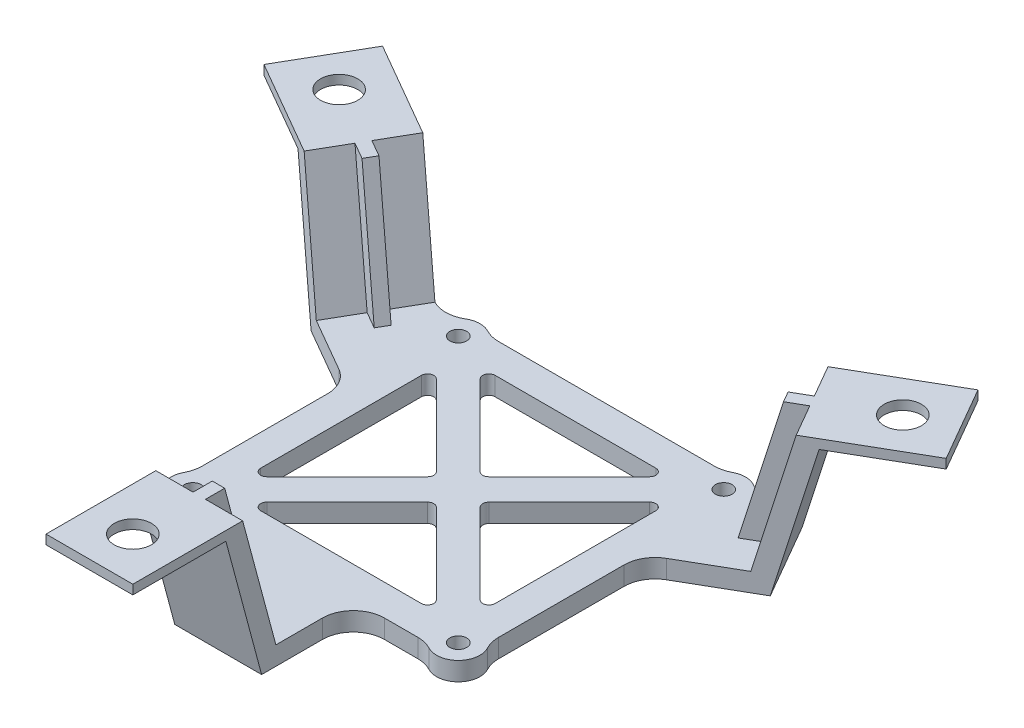
from build123d import *

# Parameters (mm, degrees)
SKETCH1_R           = 1.35
BOSS_EXTRUDE1_DEPTH = 3
FILLET1_R           = 5
FILLET2_R           = 1
BOSS_EXTRUDE2_DEPTH = 7
BOSS_EXTRUDE3_DEPTH = 1
CUT_EXTRUDE1_REACH  = 74.282
SKETCH3_R           = 3
CIRPATTERN3_COUNT   = 3


with BuildPart() as part:
    # Sketch1 → Boss-Extrude1 (new body)
    with BuildSketch(Plane(origin=(0, 0, 0), x_dir=(1, 0, 0), z_dir=(0, 1, 0))):
        with BuildLine():
            ThreePointArc((-18.950510257, 23.9), (-22.286742625, 24.785806775), (-24.760474821, 22.378370572))
            Line((-24.760474821, 22.378370572), (-28.023324698, 24.262177826))
            Line((-28.023324698, 24.262177826), (-35.023324698, 12.137822174))
            Line((-35.023324698, 12.137822174), (-23.9, 5.715767665))
            Line((-23.9, 5.715767665), (-23.9, -18.950510257))
            ThreePointArc((-23.9, -18.950510257), (-23.874873734, -23.874873734), (-18.950510257, -23.9))
            Line((-18.950510257, -23.9), (-7, -23.9))
            Line((-7, -23.9), (-7, -36.4))
            Line((-7, -36.4), (7, -36.4))
            Line((7, -36.4), (7, -23.9))
            Line((7, -23.9), (18.950510257, -23.9))
            ThreePointArc((18.950510257, -23.9), (23.874873734, -23.874873734), (23.9, -18.950510257))
            Line((23.9, -18.950510257), (23.9, 5.715767665))
            Line((23.9, 5.715767665), (35.023324698, 12.137822174))
            Line((35.023324698, 12.137822174), (28.023324698, 24.262177826))
            Line((28.023324698, 24.262177826), (24.760474821, 22.378370572))
            ThreePointArc((24.760474821, 22.378370572), (22.286742625, 24.785806775), (18.950510257, 23.9))
            Line((18.950510257, 23.9), (-18.950510257, 23.9))
        make_face()
        with Locations(Location((-21.4, -21.4, 0), (0, 0, 270))):
            Circle(SKETCH1_R, mode=Mode.SUBTRACT)
        Polygon((15.364466094, -18.9), (-15.364466094, -18.9), (0, -3.535533906), align=None, mode=Mode.SUBTRACT)
        with Locations(Location((21.4, -21.4, 0), (0, 0, 270))):
            Circle(SKETCH1_R, mode=Mode.SUBTRACT)
        Polygon((-3.535533906, 0), (-18.9, -15.364466094), (-18.9, 15.364466094), align=None, mode=Mode.SUBTRACT)
        with Locations(Location((-21.4, 21.4, 0), (0, 0, 270))):
            Circle(SKETCH1_R, mode=Mode.SUBTRACT)
        Polygon((18.9, -15.364466094), (3.535533906, 0), (18.9, 15.364466094), align=None, mode=Mode.SUBTRACT)
        Polygon((0, 3.535533906), (-15.364466094, 18.9), (15.364466094, 18.9), align=None, mode=Mode.SUBTRACT)
        with Locations(Location((21.4, 21.4, 0), (0, 0, 270))):
            Circle(SKETCH1_R, mode=Mode.SUBTRACT)
    extrude(amount=BOSS_EXTRUDE1_DEPTH)

    # Fillet1
    # the kernel refuses this fillet: 5 mm, written as the material it adds along each edge
    with BuildSketch(Plane(origin=(7, 0, 23.9), x_dir=(0, 0, 1), z_dir=(0, 1, 0)), Plane(origin=(-7, 0, 23.9), x_dir=(-1, 0, 0), z_dir=(0, 1, 0))) as fillet1_piece_1:
        with BuildLine():
            CenterArc((FILLET1_R, FILLET1_R), FILLET1_R, 180, 90)
            Line((0, FILLET1_R), (-FILLET1_R * 0.02, FILLET1_R))
            Line((-FILLET1_R * 0.02, FILLET1_R), (-FILLET1_R * 0.02, -FILLET1_R * 0.02))
            Line((-FILLET1_R * 0.02, -FILLET1_R * 0.02), (FILLET1_R, -FILLET1_R * 0.02))
            Line((FILLET1_R, -FILLET1_R * 0.02), (FILLET1_R, 0))
        make_face()
    extrude(amount=3)
    with BuildSketch(Plane(origin=(23.9, 0, 18.950510257), x_dir=(0.5912237553807399, 0, 0.8065075765753815), z_dir=(0, 1, 0)), Plane(origin=(-18.950510257, 0, 23.9), x_dir=(-0.806507576575308, 0, 0.5912237553808403), z_dir=(0, 1, 0)), Plane(origin=(18.950510257, 0, -23.9), x_dir=(0.8065075765752107, 0, -0.591223755380973), z_dir=(0, 1, 0))) as fillet1_piece_2:
        with BuildLine():
            CenterArc((1.705620507, 4.94923638), FILLET1_R, 233.756102233, 28.072486936)
            Line((-1.25049827, 0.916698497), (-1.309620646, 0.836047739))
            Line((-1.309620646, 0.836047739), (-0.059122376, -0.080650758))
            Line((-0.059122376, -0.080650758), (0.014213504, -0.098984728))
            ThreePointArc((0.014213504, -0.098984728), (0.497472648, -0.064465466), (0.980731791, -0.098984728))
            Line((0.980731791, -0.098984728), (0.994945296, 0))
        make_face()
    extrude(amount=3)
    with BuildSketch(Plane(origin=(18.950510257, 0, 23.9), x_dir=(-1, 0, 0), z_dir=(0, 1, 0)), Plane(origin=(-23.9, 0, 18.950510257), x_dir=(0, 0, -1), z_dir=(0, 1, 0)), Plane(origin=(-18.950510257, 0, -23.9), x_dir=(1, 0, 0), z_dir=(0, 1, 0))) as fillet1_piece_3:
        with BuildLine():
            CenterArc((1.550510257, 5), FILLET1_R, 241.927513064, 28.072486936)
            Line((-0.802430919, 0.588235294), (-0.849489743, 0.5))
            ThreePointArc((-0.849489743, 0.5), (-0.439328974, 0.24212576), (-0.069985421, -0.071428571))
            Line((-0.069985421, -0.071428571), (0, -0.1))
            Line((0, -0.1), (1.550510257, -0.1))
            Line((1.550510257, -0.1), (1.550510257, 0))
        make_face()
    extrude(amount=3)
    with BuildSketch(Plane(origin=(-23.9, 0, -5.715767665), x_dir=(-0.8660254037844421, 0, -0.49999999999999417), z_dir=(0, 1, 0)), Plane(origin=(23.9, 0, -5.715767665), x_dir=(0, 0, 1), z_dir=(0, 1, 0))) as fillet1_piece_4:
        with BuildLine():
            CenterArc((FILLET1_R * 0.57735026919, FILLET1_R), FILLET1_R, 210, 60)
            Line((-FILLET1_R * 0.288675134595, FILLET1_R * 0.5), (-FILLET1_R * 0.30599564267, FILLET1_R * 0.49))
            Line((-FILLET1_R * 0.30599564267, FILLET1_R * 0.49), (-FILLET1_R * 0.0115470053838, -FILLET1_R * 0.02))
            Line((-FILLET1_R * 0.0115470053838, -FILLET1_R * 0.02), (FILLET1_R * 0.57735026919, -FILLET1_R * 0.02))
            Line((FILLET1_R * 0.57735026919, -FILLET1_R * 0.02), (FILLET1_R * 0.57735026919, 0))
        make_face()
    extrude(amount=3)
    with BuildSketch(Plane(origin=(24.760474821, 0, -22.378370572), x_dir=(-0.6125107821213894, 0, -0.7904622329909531), z_dir=(0, 1, 0))) as fillet1_piece_5:
        with BuildLine():
            CenterArc((4.405584254, -4.650844222), FILLET1_R, 111.538849964, 57.883583887)
            Line((-0.509452241, -3.733011854), (-0.607752971, -3.714655207))
            ThreePointArc((-0.607752971, -3.714655207), (-0.353807697, -1.852984049), (-0.099081577, 0.013521878))
            Line((-0.099081577, 0.013521878), (0.036713202, 0.093016884))
            ThreePointArc((0.036713202, 0.093016884), (1.284962074, -0.144409045), (2.533210946, 0.093016884))
            Line((2.533210946, 0.093016884), (2.569924148, 0))
        make_face()
    extrude(amount=3)
    with BuildSketch(Plane(origin=(-24.760474821, 0, -22.378370572), x_dir=(0.6125107821216187, 0, -0.7904622329907753), z_dir=(0, 1, 0))) as fillet1_piece_6:
        with BuildLine():
            CenterArc((4.405584254, 4.650844222), FILLET1_R, 190.577566149, 57.883583887)
            Line((-0.509452241, 3.733011854), (-0.607752971, 3.714655207))
            ThreePointArc((-0.607752971, 3.714655207), (-0.353807697, 1.852984049), (-0.099081577, -0.013521878))
            Line((-0.099081577, -0.013521878), (0.036713202, -0.093016884))
            ThreePointArc((0.036713202, -0.093016884), (1.284962074, 0.144409045), (2.533210946, -0.093016884))
            Line((2.533210946, -0.093016884), (2.569924148, 0))
        make_face()
    extrude(amount=3)

    # Fillet2
    fillet2_edges = [part.edges().sort_by_distance(p)[0] for p in [
        (15.364466094, 1.5, -18.9),
        (-15.364466094, 1.5, -18.9),
        (0, 1.5, -3.535533906),
        (-18.9, 1.5, 15.364466094),
        (-3.535533906, 1.5, 0),
        (-18.9, 1.5, -15.364466094),
        (18.9, 1.5, 15.364466094),
        (18.9, 1.5, -15.364466094),
        (3.535533906, 1.5, 0),
        (-15.364466094, 1.5, 18.9),
        (15.364466094, 1.5, 18.9),
        (0, 1.5, 3.535533906),
    ]]
    fillet(fillet2_edges, radius=FILLET2_R)

    # Sketch2 → Boss-Extrude2 (add, symmetric)
    with BuildSketch(Plane(origin=(0, 0, 0), x_dir=(0, 0, -1), z_dir=(1, 0, 0))):
        Polygon((-36.4, 3), (-36.4, 0), (-38.701980964, 0), (-44.462888601, 21.5), (-59.462888601, 21.5), (-59.462888601, 23), (-41.758983849, 23), align=None)
    boss_extrude2 = extrude(amount=BOSS_EXTRUDE2_DEPTH, both=True)

    # Sketch2<3> → Boss-Extrude3 (add, symmetric)
    with BuildSketch(Plane(origin=(0, 0, 0), x_dir=(0, 0, -1), z_dir=(1, 0, 0))):
        Polygon((-33.294171459, 3), (-36.4, 3), (-41.758983849, 23), (-38.653155307, 23), align=None)
    boss_extrude3 = extrude(amount=BOSS_EXTRUDE3_DEPTH, both=True)

    # Sketch3 → Cut-Extrude1 (cut, up to next)
    with BuildSketch(Plane.XZ.offset(-21.5), mode=Mode.PRIVATE) as cut_extrude1_sk1:
        with Locations(Location((0, 52.462888601, 0), (0, 0, 270))):
            Circle(SKETCH3_R)
    cut_extrude1_tool1 = extrude(cut_extrude1_sk1.sketch, amount=-CUT_EXTRUDE1_REACH, mode=Mode.PRIVATE) & part.part
    cut_extrude1 = cut_extrude1_tool1.solids().sort_by_distance((0, 21.5, 52.462889))[0]
    add(cut_extrude1, mode=Mode.SUBTRACT)

    # CirPattern3: Boss-Extrude2, Boss-Extrude3, Cut-Extrude1 ×3 about axis
    cirpattern3_axis = Axis((0, 0, 0), (0, 1, 0))
    add([boss_extrude2.rotate(cirpattern3_axis, i * 360 / CIRPATTERN3_COUNT) for i in range(1, CIRPATTERN3_COUNT)])
    add([boss_extrude3.rotate(cirpattern3_axis, i * 360 / CIRPATTERN3_COUNT) for i in range(1, CIRPATTERN3_COUNT)])
    add([cut_extrude1.rotate(cirpattern3_axis, i * 360 / CIRPATTERN3_COUNT) for i in range(1, CIRPATTERN3_COUNT)], mode=Mode.SUBTRACT)


solid = part.part
